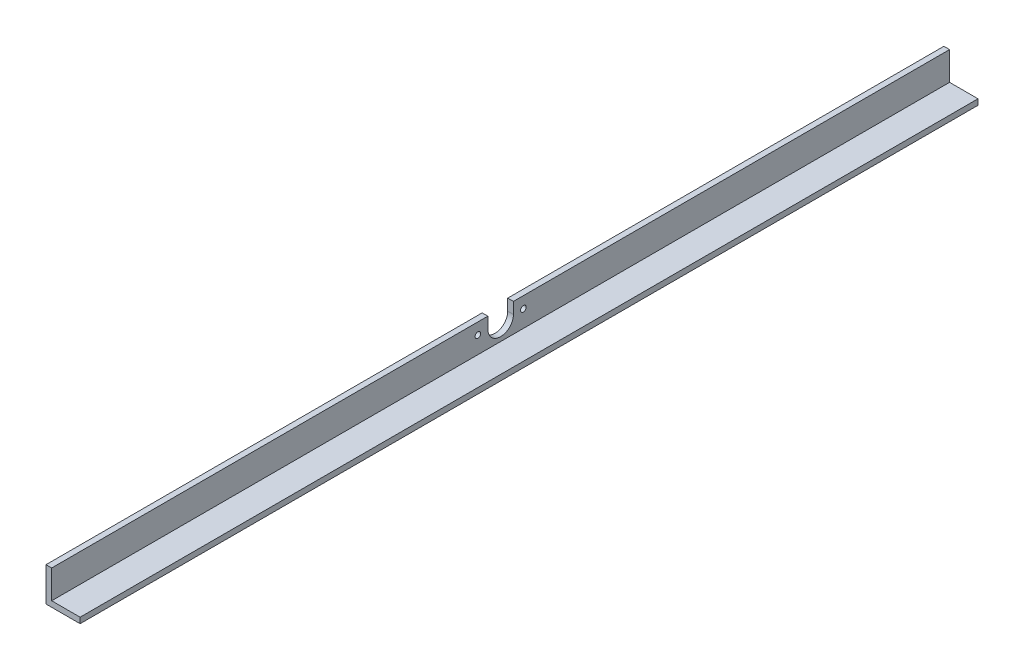
from build123d import *

# Parameters (mm, degrees)
BOSS_EXTRUDE1_DEPTH = 1003.3
CUT_EXTRUDE1_REACH  = 1006.525
SKETCH2_R           = 3.175


with BuildPart() as part:
    # Sketch1 → Boss-Extrude1 (new body)
    with BuildSketch(Plane.XY):
        Polygon((0, 0), (0, 38.1), (6.35, 38.1), (6.35, 6.35), (38.1, 6.35), (38.1, 0), align=None)
    extrude(amount=BOSS_EXTRUDE1_DEPTH)

    # Sketch2 → Cut-Extrude1 (cut, up to next)
    with BuildSketch(Plane(origin=(6.35, 0, 0), x_dir=(0, 0, -1), z_dir=(1, 0, 0)), mode=Mode.PRIVATE) as cut_extrude1_sk1:
        with BuildLine():
            Line((-515.9375, 38.1), (-515.9375, 25.4))
            ThreePointArc((-515.9375, 25.4), (-501.65, 11.1125), (-487.3625, 25.4))
            Line((-487.3625, 25.4), (-487.3625, 38.1))
            Line((-487.3625, 38.1), (-515.9375, 38.1))
        make_face()
    cut_extrude1_tool1 = extrude(cut_extrude1_sk1.sketch, amount=-CUT_EXTRUDE1_REACH, mode=Mode.PRIVATE) & part.part
    # Sketch2 → Cut-Extrude1 (cut, up to next)
    with BuildSketch(Plane(origin=(6.35, 0, 0), x_dir=(0, 0, -1), z_dir=(1, 0, 0)), mode=Mode.PRIVATE) as cut_extrude1_sk2:
        with Locations((-527.05, 25.4)):
            Circle(SKETCH2_R)
    cut_extrude1_tool2 = extrude(cut_extrude1_sk2.sketch, amount=-CUT_EXTRUDE1_REACH, mode=Mode.PRIVATE) & part.part
    # Sketch2 → Cut-Extrude1 (cut, up to next)
    with BuildSketch(Plane(origin=(6.35, 0, 0), x_dir=(0, 0, -1), z_dir=(1, 0, 0)), mode=Mode.PRIVATE) as cut_extrude1_sk3:
        with Locations((-476.25, 25.4)):
            Circle(SKETCH2_R)
    cut_extrude1_tool3 = extrude(cut_extrude1_sk3.sketch, amount=-CUT_EXTRUDE1_REACH, mode=Mode.PRIVATE) & part.part
    add(cut_extrude1_tool1.solids().sort_by_distance((6.35, 25.926758, 501.65))[0], mode=Mode.SUBTRACT)
    add(cut_extrude1_tool2.solids().sort_by_distance((6.35, 25.4, 527.05))[0], mode=Mode.SUBTRACT)
    add(cut_extrude1_tool3.solids().sort_by_distance((6.35, 25.4, 476.25))[0], mode=Mode.SUBTRACT)


solid = part.part
